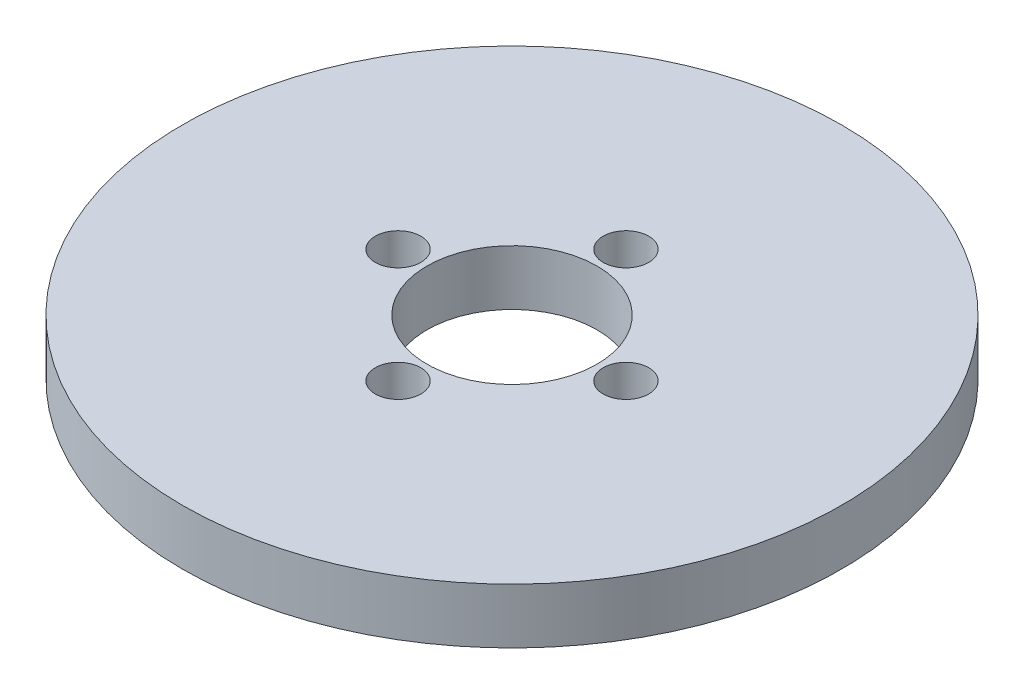
from build123d import *

# Parameters (mm, degrees)
SKETCH1_R           = 77.5
BOSS_EXTRUDE1_DEPTH = 13
SKETCH2_R           = 20
CUT_EXTRUDE1_DEPTH  = 111.369832835
SKETCH3_R           = 5.357526039
CUT_EXTRUDE2_DEPTH  = 8.970124098
CIRPATTERN1_COUNT   = 4


with BuildPart() as part:
    # Sketch1 → Boss-Extrude1 (new body)
    with BuildSketch(Plane(origin=(0, 0, 0), x_dir=(1, 0, 0), z_dir=(0, 1, 0))):
        Circle(SKETCH1_R)
    extrude(amount=BOSS_EXTRUDE1_DEPTH)

    # Sketch2 → Cut-Extrude1 (cut, through all)
    with BuildSketch(Plane(origin=(0, 0, 0), x_dir=(1, 0, 0), z_dir=(0, 1, 0))):
        Circle(SKETCH2_R)
    extrude(amount=CUT_EXTRUDE1_DEPTH, mode=Mode.SUBTRACT)

    # Sketch3 → Cut-Extrude2 (cut)
    with BuildSketch(Plane(origin=(0, 13, 0), x_dir=(1, 0, 0), z_dir=(0, 1, 0))):
        with Locations((-26.797204865, 0)):
            Circle(SKETCH3_R)
    cut_extrude2 = extrude(amount=-CUT_EXTRUDE2_DEPTH, mode=Mode.SUBTRACT)

    # CirPattern1: Cut-Extrude2 ×4 about axis
    cirpattern1_axis = Axis((0, 0, 0), (0, 1, 0))
    for i in range(1, CIRPATTERN1_COUNT):
        add(cut_extrude2.rotate(cirpattern1_axis, i * 360 / CIRPATTERN1_COUNT), mode=Mode.SUBTRACT)


solid = part.part
